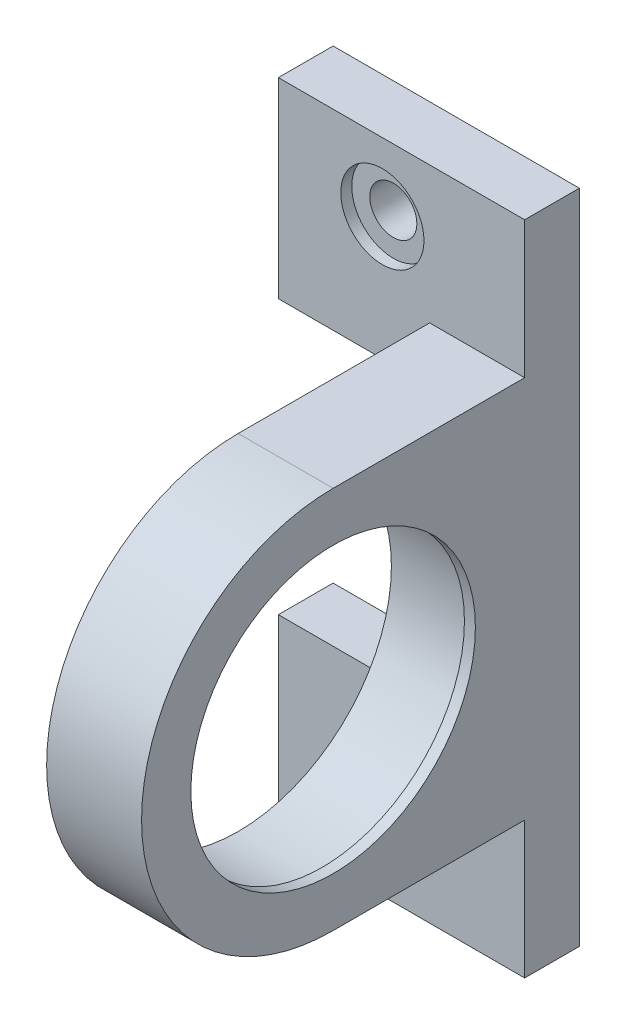
from build123d import *

# Parameters (mm, degrees)
SKETCH_2_W                     = 45
SKETCH_2_H                     = 60
SKETCH_2_W_2                   = 27.647058823
SKETCH_2_H_2                   = 25
EXTRUDE_2_DEPTH                = 5
SKETCH_4_W                     = 8.676470589
SKETCH_4_H                     = 35
SKETCH_4_W_2                   = 8.676470588
EXTRUDE_15_DEPTH               = 35
CUT_EXTRUDE_1_DEPTH            = 45
SKETCH_6_R                     = 14
CUT_EXTRUDE_2_DEPTH            = 45
FILLET_1_R                     = 5
SKETCH_7_R                     = 15
SKETCH_7_R_2                   = 13
EXTRUDE_16_DEPTH               = 1
SPLIT_BODIES_1_SURFACE_1_BACK  = 86
SPLIT_BODIES_1_SURFACE_1_DEPTH = 172
SPLIT_BODIES_1_SURFACE_2_BACK  = 86
SPLIT_BODIES_1_SURFACE_2_DEPTH = 172
HOLE_WIZARD_1_D                = 4.3
HOLE_WIZARD_1_DEPTH            = 5
HOLE_WIZARD_1_CBORE_D          = 7.6
HOLE_WIZARD_1_CBORE_DEPTH      = 1
HOLE_WIZARD_1_TIP              = 1.291850331
EXTRUDE_START                  = -1
SKETCH_14_R                    = 14
SKETCH_14_R_2                  = 13
EXTRUDE_1_DEPTH                = 1


with BuildPart() as part:
    # 草图2 → 凸台-拉伸2 (new body)
    with BuildSketch(Plane.XY):
        with Locations((7.726423565, -5.661764706)):
            Rectangle(SKETCH_2_W, SKETCH_2_H)
        with Locations((7.726423565, -5.661764706)):
            Rectangle(SKETCH_2_W_2, SKETCH_2_H_2, mode=Mode.SUBTRACT)
    extrude(amount=EXTRUDE_2_DEPTH)

    # 草图4 → 凸台-拉伸15 (add)
    with BuildSketch(Plane.XY.offset(5)):
        with Locations((-10.435341141, -5.661764706)):
            Rectangle(SKETCH_4_W, SKETCH_4_H)
        with Locations((25.888188271, -5.661764706)):
            Rectangle(SKETCH_4_W_2, SKETCH_4_H)
    extrude(amount=EXTRUDE_15_DEPTH)

    # 草图5 → 切除-拉伸1 (cut)
    with BuildSketch(Plane.ZY.offset(14.773576435)):
        with BuildLine():
            ThreePointArc((22.5, 11.838235294), (34.874368671, 6.712603965), (40, -5.661764706))
            Line((40, -5.661764706), (40, 11.838235294))
            Line((40, 11.838235294), (22.5, 11.838235294))
        make_face()
        with BuildLine():
            Line((40, -23.161764706), (40, -5.661764706))
            ThreePointArc((40, -5.661764706), (34.874368671, -18.036133377), (22.5, -23.161764706))
            Line((22.5, -23.161764706), (40, -23.161764706))
        make_face()
    extrude(amount=-CUT_EXTRUDE_1_DEPTH, mode=Mode.SUBTRACT)

    # 草图6 → 切除-拉伸2 (cut)
    with BuildSketch(Plane.ZY.offset(14.773576435)):
        with Locations((22.5, -5.661764706)):
            Circle(SKETCH_6_R)
    extrude(amount=-CUT_EXTRUDE_2_DEPTH, mode=Mode.SUBTRACT)

    # 圆角1
    fillet_1_edges = [part.edges().sort_by_distance(p)[0] for p in [
        (-6.097105846, 6.838235294, 2.5),
        (21.549952977, 6.838235294, 2.5),
        (-6.097105846, -18.161764706, 2.5),
        (21.549952977, -18.161764706, 2.5),
    ]]
    fillet(fillet_1_edges, radius=FILLET_1_R)

    # 草图7 → 凸台-拉伸16 (add)
    with BuildSketch(Plane(origin=(-6.097105846, 0, 0), x_dir=(0, 0, -1), z_dir=(1, 0, 0))):
        with Locations((-22.5, -5.661764706)):
            Circle(SKETCH_7_R)
        with Locations((-22.5, -5.661764706)):
            Circle(SKETCH_7_R_2, mode=Mode.SUBTRACT)
    extrude(amount=-EXTRUDE_16_DEPTH)


with BuildPart() as body_2:
    # Split Bodies 1: the piece behind the surface
    add(part.part)
    # Split Bodies 1 surface: a surface, the sketch's curves swept straight by 172 mm
    with BuildLine(Plane.XY.offset(5).offset(-SPLIT_BODIES_1_SURFACE_1_BACK), mode=Mode.PRIVATE) as split_bodies_1_surface_1_path:
        Line((7.726423565, 24.338235294), (7.726423565, -35.661764706))
    split_bodies_1_surface_1 = Shell.extrude(split_bodies_1_surface_1_path.wire(), (0 * SPLIT_BODIES_1_SURFACE_1_DEPTH, 0 * SPLIT_BODIES_1_SURFACE_1_DEPTH, 1 * SPLIT_BODIES_1_SURFACE_1_DEPTH))
    split(bisect_by=split_bodies_1_surface_1, keep=Keep.BOTTOM)


with BuildPart() as part_1:
    add(part.part)

    # Split Bodies 1: split by a surface, the side it looks to stays
    # Split Bodies 1 surface: a surface, the sketch's curves swept straight by 172 mm
    with BuildLine(Plane.XY.offset(5).offset(-SPLIT_BODIES_1_SURFACE_2_BACK), mode=Mode.PRIVATE) as split_bodies_1_surface_2_path:
        Line((7.726423565, 24.338235294), (7.726423565, -35.661764706))
    split_bodies_1_surface_2 = Shell.extrude(split_bodies_1_surface_2_path.wire(), (0 * SPLIT_BODIES_1_SURFACE_2_DEPTH, 0 * SPLIT_BODIES_1_SURFACE_2_DEPTH, 1 * SPLIT_BODIES_1_SURFACE_2_DEPTH))
    split(bisect_by=split_bodies_1_surface_2, keep=Keep.TOP)

    # 打孔尺寸(%根据六角头螺)栓 全螺纹的类型1
    with Locations(Plane(origin=(17.226423565, 18.088235294, 5), x_dir=(1, 0, 0), z_dir=(0, 0, 1))):
        with Locations((0, 0), (0, -47.5)):
            CounterBoreHole(HOLE_WIZARD_1_D / 2, HOLE_WIZARD_1_CBORE_D / 2, HOLE_WIZARD_1_CBORE_DEPTH, depth=HOLE_WIZARD_1_DEPTH)
            with Locations((0, 0, -(HOLE_WIZARD_1_DEPTH + HOLE_WIZARD_1_TIP / 2))):  # 118° drill point
                Cone(0, HOLE_WIZARD_1_D / 2, HOLE_WIZARD_1_TIP, mode=Mode.SUBTRACT)

    # 草图14 → 拉伸-薄壁1 (add)
    with BuildSketch(Plane(origin=(30.226423565, 0, 0), x_dir=(0, 0, -1), z_dir=(1, 0, 0)).offset(EXTRUDE_START)):
        with Locations((-22.5, -5.661764706)):
            Circle(SKETCH_14_R)
        with Locations((-22.5, -5.661764706)):
            Circle(SKETCH_14_R_2, mode=Mode.SUBTRACT)
    extrude(amount=EXTRUDE_1_DEPTH)


solid = part_1.part
